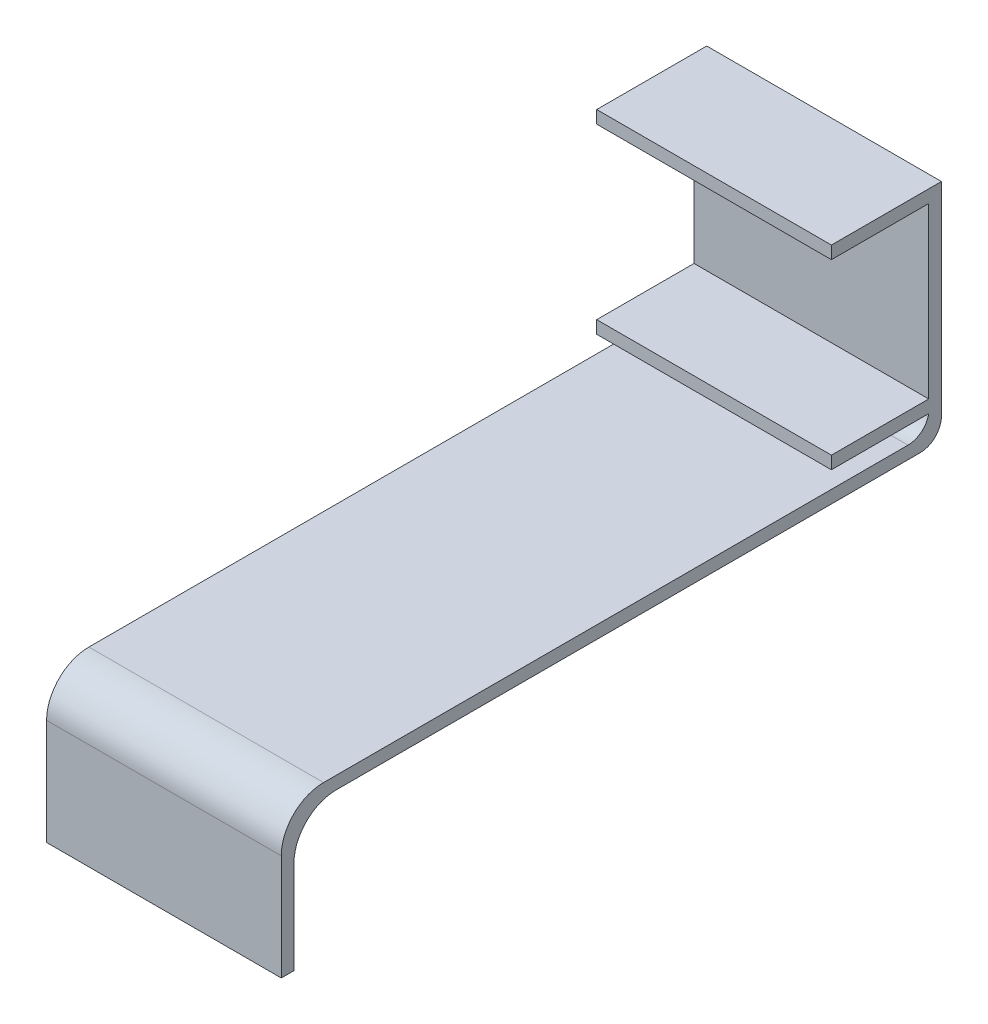
from build123d import *

# Parameters (mm, degrees)
SKETCH6_W           = 55.461011284
SKETCH6_H           = 53
BOSS_EXTRUDE5_DEPTH = 3
SKETCH7_W           = 55.461011284
SKETCH7_H           = 3
BOSS_EXTRUDE6_DEPTH = 23
SKETCH8_W           = 55.461011284
SKETCH8_H           = 3
BOSS_EXTRUDE7_DEPTH = 150
SKETCH9_W           = 55.461011284
SKETCH9_H           = 35
BOSS_EXTRUDE8_DEPTH = 3
FILLET2_R           = 10
FILLET3_R           = 10
FILLET5_R           = 5
FILLET6_R           = 5


with BuildPart() as part:
    # Sketch6 → Boss-Extrude5 (new body)
    with BuildSketch(Plane.XY):
        Rectangle(SKETCH6_W, SKETCH6_H)
    extrude(amount=BOSS_EXTRUDE5_DEPTH)

    # Sketch7 → Boss-Extrude6 (add)
    with BuildSketch(Plane.XY.offset(3)):
        with Locations((0, 25)):
            Rectangle(SKETCH7_W, SKETCH7_H)
        with Locations((0, -18)):
            Rectangle(SKETCH7_W, SKETCH7_H)
    extrude(amount=BOSS_EXTRUDE6_DEPTH)

    # Sketch8 → Boss-Extrude7 (add)
    with BuildSketch(Plane.XY.offset(3)):
        with Locations((0, -25)):
            Rectangle(SKETCH8_W, SKETCH8_H)
    extrude(amount=BOSS_EXTRUDE7_DEPTH)

    # Sketch9 → Boss-Extrude8 (add)
    with BuildSketch(Plane.XY.offset(153)):
        with Locations((0, -41)):
            Rectangle(SKETCH9_W, SKETCH9_H)
    extrude(amount=BOSS_EXTRUDE8_DEPTH)

    # Fillet2
    fillet2_edges = [part.edges().sort_by_distance(p)[0] for p in [
        (0, -26.5, 153),
    ]]
    fillet(fillet2_edges, radius=FILLET2_R)

    # Fillet3
    fillet3_edges = [part.edges().sort_by_distance(p)[0] for p in [
        (0, -23.5, 156),
    ]]
    fillet(fillet3_edges, radius=FILLET3_R)

    # Fillet5
    fillet5_edges = [part.edges().sort_by_distance(p)[0] for p in [
        (0, -26.5, 0),
    ]]
    fillet(fillet5_edges, radius=FILLET5_R)

    # Fillet6
    # the kernel refuses this fillet: 5 mm, written as the material it adds along each edge
    with BuildSketch(Plane(origin=(-27.730505642, -23.5, 3), x_dir=(0, 0, 1), z_dir=(1, 0, 0))) as fillet6_piece_1:
        with BuildLine():
            CenterArc((4.898979486, -5), FILLET6_R, 90, 78.463040967)
            Line((0, -4), (-0.09797959, -3.98))
            ThreePointArc((-0.09797959, -3.98), (-0.1, -2), (-0.1, 0))
            Line((-0.1, 0), (0, 0.1))
            Line((0, 0.1), (4.898979486, 0.1))
            Line((4.898979486, 0.1), (4.898979486, 0))
        make_face()
    extrude(amount=55.461011285)


solid = part.part
